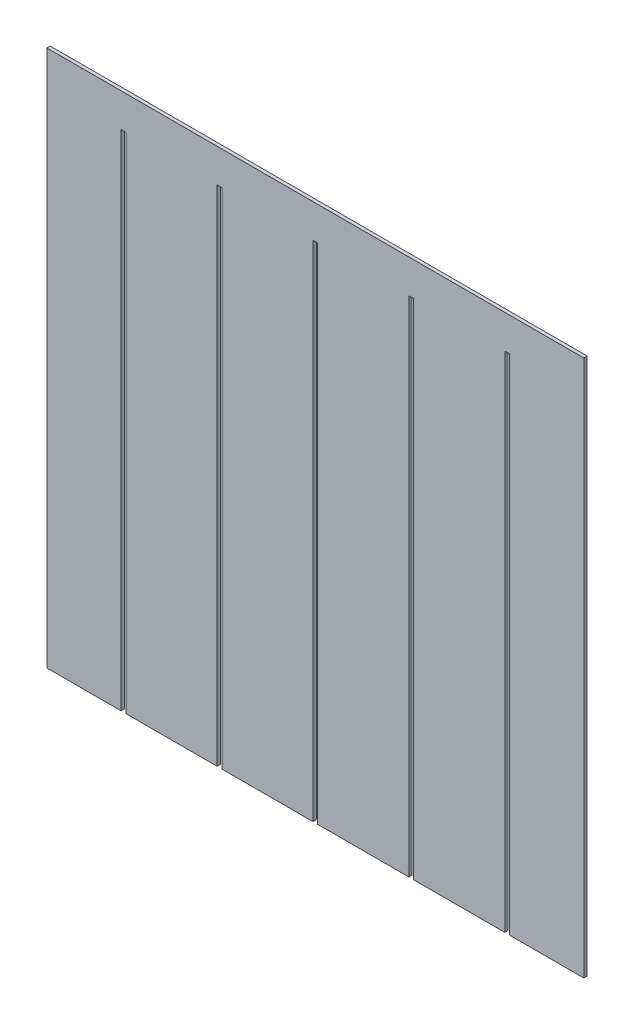
from build123d import *

# Parameters (mm, degrees)
EXTRUDE_2_DEPTH = 1


with BuildPart() as part:
    # 草图1 → 凸台-拉伸2 (new body)
    with BuildSketch(Plane.XY):
        Polygon((-57.86, -80), (-57.86, 70), (-56.46, 70), (-56.46, -80), (-34.28, -80), (-29.28, -80), (-29.28, 70), (-27.88, 70), (-27.88, -80), (-5.7, -80), (-0.7, -80), (-0.7, 70), (0.7, 70), (0.7, -80), (22.88, -80), (27.88, -80), (27.88, 70), (29.28, 70), (29.28, -80), (51.46, -80), (56.46, -80), (56.46, 70), (57.86, 70), (57.86, -80), (80, -80), (80, 80), (-80, 80), (-80, -80), (-62.86, -80), align=None)
    extrude(amount=EXTRUDE_2_DEPTH)


solid = part.part
